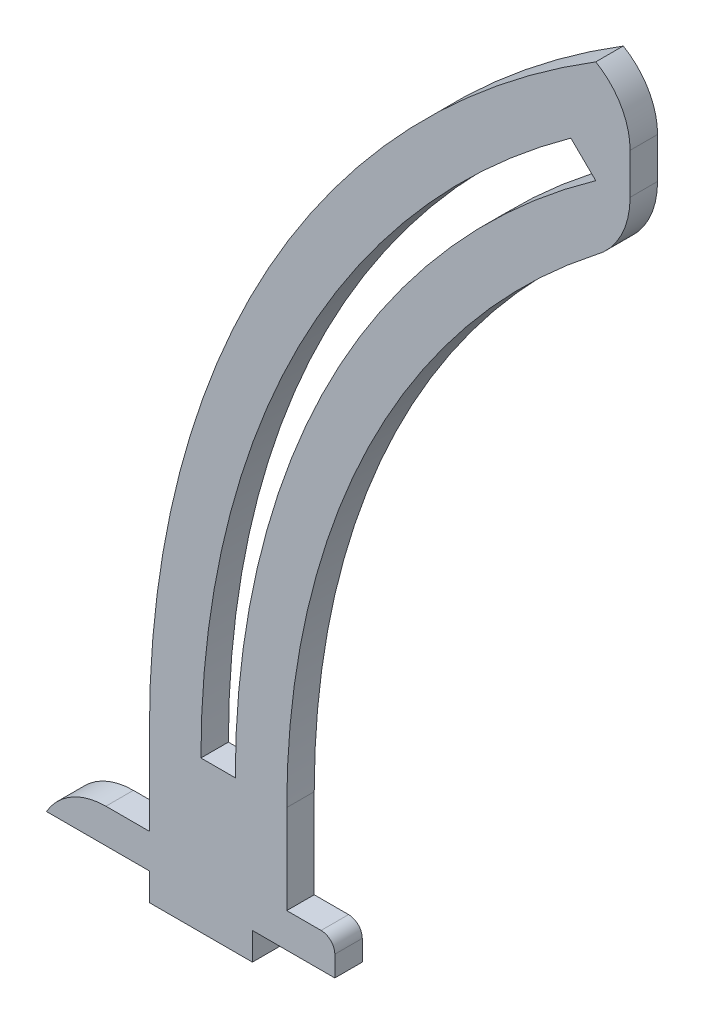
from build123d import *

# Parameters (mm, degrees)
EXTRUDE_THIN2_DEPTH          = 5.08
CUT_EXTRUDE_THIN3_DEPTH      = 247.111451582
CUT_EXTRUDE_THIN3_DEPTH_BACK = 5.08
SKETCH9_W                    = 25.4
SKETCH9_H                    = 5.08
BOSS_EXTRUDE3_DEPTH          = 22.86
BOSS_EXTRUDE4_DEPTH          = 19.05
BOSS_EXTRUDE4_DEPTH_BACK     = 34.29
SKETCH10_W                   = 5.08
SKETCH10_H                   = 6.35
SKETCH11_W                   = 12.7
SKETCH11_H                   = 5.08
BOSS_EXTRUDE5_DEPTH          = 5.08
SKETCH12_W                   = 168.813467259
SKETCH12_H                   = 220.237806267
CUT_EXTRUDE1_DEPTH           = 260.928390331
SKETCH13_W                   = 5.08
SKETCH13_H                   = 30.900567514
BOSS_EXTRUDE6_DEPTH          = 6.35
FILLET2_R                    = 15.24
FILLET3_R                    = 12.7
FILLET4_R                    = 12.7
FILLET5_R                    = 2.54
BOSS_EXTRUDE14_DEPTH         = 5.08
SKETCH16_W                   = 5.08
SKETCH16_H                   = 5.08
BOSS_EXTRUDE15_DEPTH         = 6.35


with BuildPart() as part:
    # Sketch7 → Extrude-Thin2 (new body)
    with BuildSketch(Plane.XY):
        with BuildLine():
            ThreePointArc((-173.99, 0), (-123.029508859, 123.029508859), (0, 173.99))
            Line((0, 173.99), (0, 148.59))
            ThreePointArc((0, 148.59), (-105.068996617, 105.068996617), (-148.59, 0))
            Line((-148.59, 0), (-173.99, 0))
        make_face()
    extrude(amount=EXTRUDE_THIN2_DEPTH)

    # Sketch8 → Cut-Extrude-Thin3 (cut, two sides: drawn at the far end of the back side and taken through both)
    with BuildSketch(Plane.XY.offset(5.08).offset(-CUT_EXTRUDE_THIN3_DEPTH_BACK)):
        with BuildLine():
            ThreePointArc((-164.465, 0), (-116.294316768, 116.294316768), (0, 164.465))
            Line((0, 164.465), (0, 158.115))
            ThreePointArc((0, 158.115), (-111.804188707, 111.804188707), (-158.115, 0))
            Line((-158.115, 0), (-164.465, 0))
        make_face()
    extrude(amount=CUT_EXTRUDE_THIN3_DEPTH + CUT_EXTRUDE_THIN3_DEPTH_BACK, mode=Mode.SUBTRACT)


with BuildPart() as cut_extrude_thin3_piece_1:
    # of the separate pieces the step leaves, piece 1, a body of its own (cut_extrude_thin3_pieces)
    add(part.part.solids().sort_by_distance((0, 173.99, 0))[0])



with BuildPart() as cut_extrude_thin3_piece_2:
    # of the separate pieces the step leaves, piece 2, a body of its own (cut_extrude_thin3_pieces)
    add(part.part.solids().sort_by_distance((0, 158.115, 0))[0])


with BuildPart() as cut_extrude_thin3_piece_1_1:
    add(cut_extrude_thin3_piece_1.part)

    add(cut_extrude_thin3_piece_2.part)  # Boss-Extrude3 merges Cut-Extrude-Thin3 piece 2
    # Sketch9 → Boss-Extrude3 (add)
    with BuildSketch(Plane.XZ):
        with Locations((-161.29, 2.54)):
            Rectangle(SKETCH9_W, SKETCH9_H)
    extrude(amount=BOSS_EXTRUDE3_DEPTH)

    # Sketch10 → Boss-Extrude4 (add, two sides: drawn at the far end of the back side and taken through both)
    with BuildSketch(Plane.ZY.offset(173.99).offset(-BOSS_EXTRUDE4_DEPTH_BACK)):
        with Locations((2.54, -19.685)):
            Rectangle(SKETCH10_W, SKETCH10_H)
    extrude(amount=BOSS_EXTRUDE4_DEPTH + BOSS_EXTRUDE4_DEPTH_BACK)

    # Sketch11 → Boss-Extrude5 (add)
    with BuildSketch(Plane.XZ.offset(22.86)):
        with Locations((-161.29, 2.54)):
            Rectangle(SKETCH11_W, SKETCH11_H)
    extrude(amount=BOSS_EXTRUDE5_DEPTH)

    # Sketch12 → Cut-Extrude1 (cut, through all)
    with BuildSketch(Plane.XY.offset(5.08)):
        with Locations((-7.025506372, 87.258903133)):
            Rectangle(SKETCH12_W, SKETCH12_H)
    extrude(amount=-CUT_EXTRUDE1_DEPTH, mode=Mode.SUBTRACT)

    # Sketch13 → Boss-Extrude6 (add)
    with BuildSketch(Plane(origin=(-91.432240001, 0, 0), x_dir=(0, 0, -1), z_dir=(1, 0, 0))):
        with Locations((-2.54, 132.578988985)):
            Rectangle(SKETCH13_W, SKETCH13_H)
    extrude(amount=BOSS_EXTRUDE6_DEPTH)

    # Fillet2
    # the kernel refuses this fillet: 15.24 mm, written as the material it takes off along each edge
    with BuildSketch(Plane(origin=(-85.082240001, 117.128705228, -30.946072045), x_dir=(-1, 0, 0), z_dir=(0, 0, 1))) as fillet2_piece_1:
        with BuildLine():
            CenterArc((15.24, -12.378428818), FILLET2_R, 125.685334713, 54.314665287)
            Line((0, -12.378428818), (-0.3048, -12.378428818))
            Line((-0.3048, -12.378428818), (-0.3048, 0))
            Line((-0.3048, 0), (0, 0.3048))
            ThreePointArc((0, 0.3048), (3.175, 0.3048), (6.1722, 0.247568576))
            Line((6.1722, 0.247568576), (6.35, 0))
        make_face()
    extrude(amount=66.97214409, mode=Mode.SUBTRACT)

    # Fillet3
    # the kernel refuses this fillet: 12.7 mm, written as the material it takes off along each edge
    with BuildSketch(Plane(origin=(-85.082240001, 148.029272742, 32.57630657), x_dir=(0, -1, 0), z_dir=(0, 0, -1))) as fillet3_piece_1:
        with BuildLine():
            CenterArc((10.998522628, 12.7), FILLET3_R, 210, 60)
            Line((0, 6.35), (-0.219970453, 6.223))
            ThreePointArc((-0.219970453, 6.223), (-0.254, 3.175), (-0.254, 0))
            Line((-0.254, 0), (0, -0.254))
            Line((0, -0.254), (10.998522628, -0.254))
            Line((10.998522628, -0.254), (10.998522628, 0))
        make_face()
    extrude(amount=60.07261314, mode=Mode.SUBTRACT)

    # Fillet4
    # the kernel refuses this fillet: 12.7 mm, written as the material it takes off along each edge
    with BuildSketch(Plane(origin=(-193.04, -16.51, 32.57630657), x_dir=(1, 0, 0), z_dir=(0, 0, -1))) as fillet4_piece_1:
        with BuildLine():
            CenterArc((10.998522628, 12.7), FILLET4_R, 210, 60)
            Line((0, 6.35), (-0.219970453, 6.223))
            ThreePointArc((-0.219970453, 6.223), (-0.254, 3.175), (-0.254, 0))
            Line((-0.254, 0), (0, -0.254))
            Line((0, -0.254), (10.998522628, -0.254))
            Line((10.998522628, -0.254), (10.998522628, 0))
        make_face()
    extrude(amount=60.07261314, mode=Mode.SUBTRACT)

    # Fillet5
    fillet5_edges = [cut_extrude_thin3_piece_1_1.edges().sort_by_distance(p)[0] for p in [
        (-139.7, -16.51, 2.54),
    ]]
    fillet(fillet5_edges, radius=FILLET5_R)

    # Sketch15 → Boss-Extrude14 (add)
    with BuildSketch(Plane.XY):
        Polygon((-91.432240001, 128.998057014), (-96.042586765, 133.508642988), (-90.011669105, 142.911064998), (-86.217351324, 133.783124359), align=None)
    extrude(amount=BOSS_EXTRUDE14_DEPTH)

    # Sketch16 → Boss-Extrude15 (add)
    with BuildSketch(Plane.ZY.offset(167.64)):
        with Locations((2.54, -25.4)):
            Rectangle(SKETCH16_W, SKETCH16_H)
    extrude(amount=BOSS_EXTRUDE15_DEPTH)


solid = cut_extrude_thin3_piece_1_1.part
